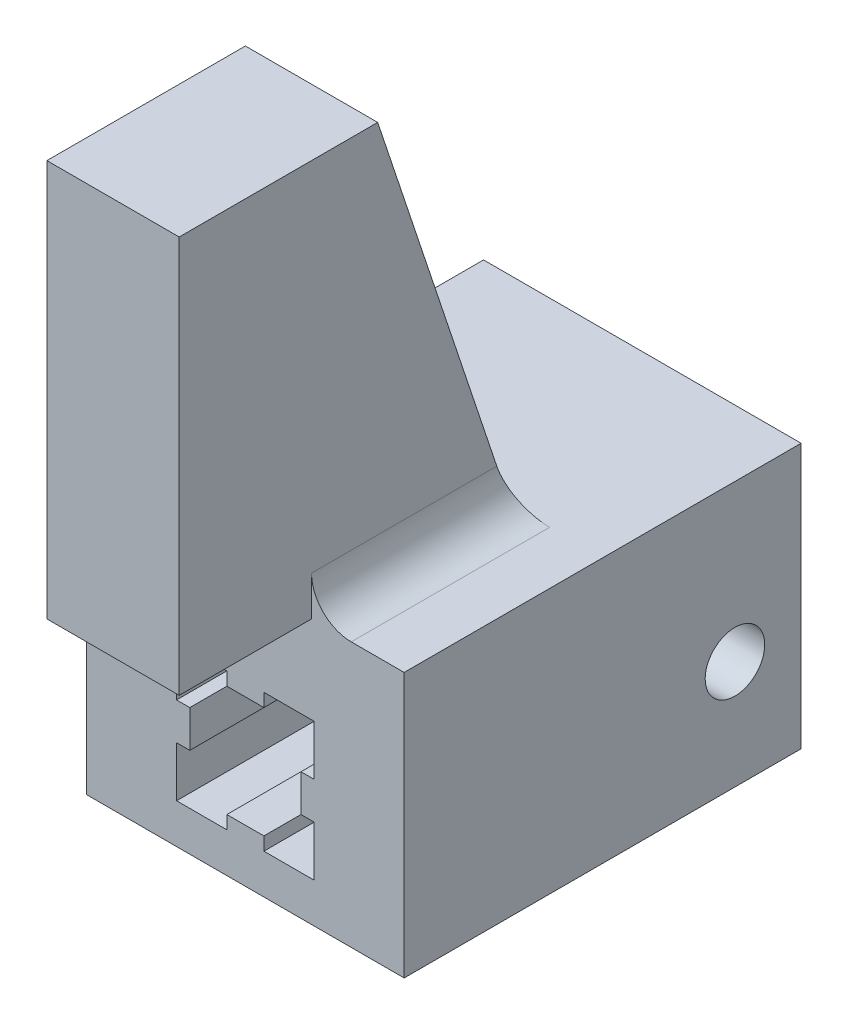
from build123d import *

# Parameters (mm, degrees)
ESQUISSE1_W            = 24
ESQUISSE1_H            = 20
MAIN_EXTRUSION_DEPTH   = 30
MAIN_RIDING_HOLE_DEPTH = 34.823069051
ESQUISSE4_R            = 2.25
TRACTORHOLE_DEPTH      = 8
IMPACTPIECE_DEPTH      = 5
CONG_1_R               = 3


with BuildPart() as part:
    # Esquisse1 → Main Extrusion (new body)
    with BuildSketch(Plane.XY):
        Rectangle(ESQUISSE1_W, ESQUISSE1_H)
    extrude(amount=MAIN_EXTRUSION_DEPTH)

    # Esquisse3 → Main Riding Hole (cut, through all)
    with BuildSketch(Plane(origin=(0, 0, 0), x_dir=(-1, 0, 0), z_dir=(0, 0, -1))):
        Polygon((-5.2, 3.4), (-5.2, -0.4), (-4.2, -0.4), (-4.2, -3.2), (-5.2, -3.2), (-5.2, -7), (-1.4, -7), (-1.4, -6), (1.4, -6), (1.4, -7), (5.2, -7), (5.2, -3.2), (4.2, -3.2), (4.2, -0.4), (5.2, -0.4), (5.2, 3.4), (1.4, 3.4), (1.4, 2.4), (-1.4, 2.4), (-1.4, 3.4), align=None)
    extrude(amount=-MAIN_RIDING_HOLE_DEPTH, mode=Mode.SUBTRACT)

    # Esquisse4 → TractorHole (cut)
    with BuildSketch(Plane.ZY.offset(12)):
        with Locations((5, -1.8)):
            Circle(ESQUISSE4_R)
    tractorhole = extrude(amount=-TRACTORHOLE_DEPTH, mode=Mode.SUBTRACT)

    # TractorHoleSymetry: TractorHole across plane
    add(tractorhole.mirror(Plane(origin=(0, 0, 0), x_dir=(0, 0, 1), z_dir=(1, 0, 0))), mode=Mode.SUBTRACT)

    # Esquisse5 → ImpactPiece (add, symmetric)
    with BuildSketch(Plane(origin=(0, 0, 0), x_dir=(0, 0, -1), z_dir=(1, 0, 0))):
        Polygon((-40, 10), (-40, 40), (-25, 40), (-15, 10), align=None)
    extrude(amount=IMPACTPIECE_DEPTH, both=True)

    # Congé1
    cong_1_edges = [part.edges().sort_by_distance(p)[0] for p in [
        (-5, 10, 22.5),
        (5, 10, 22.5),
    ]]
    fillet(cong_1_edges, radius=CONG_1_R)


solid = part.part
